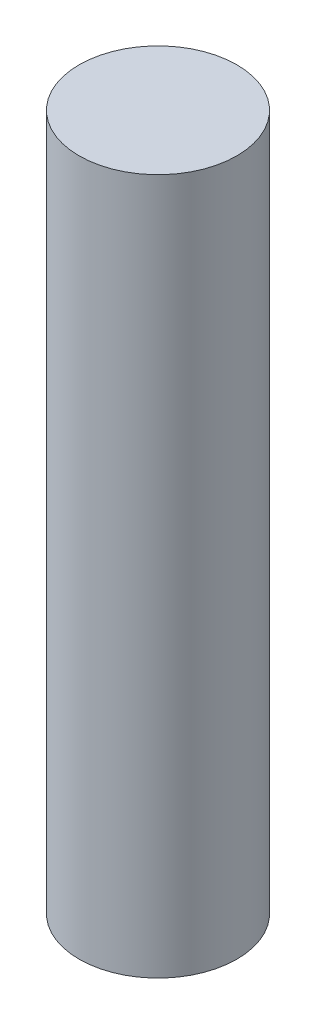
from build123d import *

# Parameters (mm, degrees)
SKETCH1_R           = 3.96875
BOSS_EXTRUDE1_DEPTH = 35


with BuildPart() as part:
    # Sketch1 → Boss-Extrude1 (new body)
    with BuildSketch(Plane(origin=(0, 0, 0), x_dir=(1, 0, 0), z_dir=(0, 1, 0))):
        Circle(SKETCH1_R)
    extrude(amount=BOSS_EXTRUDE1_DEPTH)


solid = part.part
